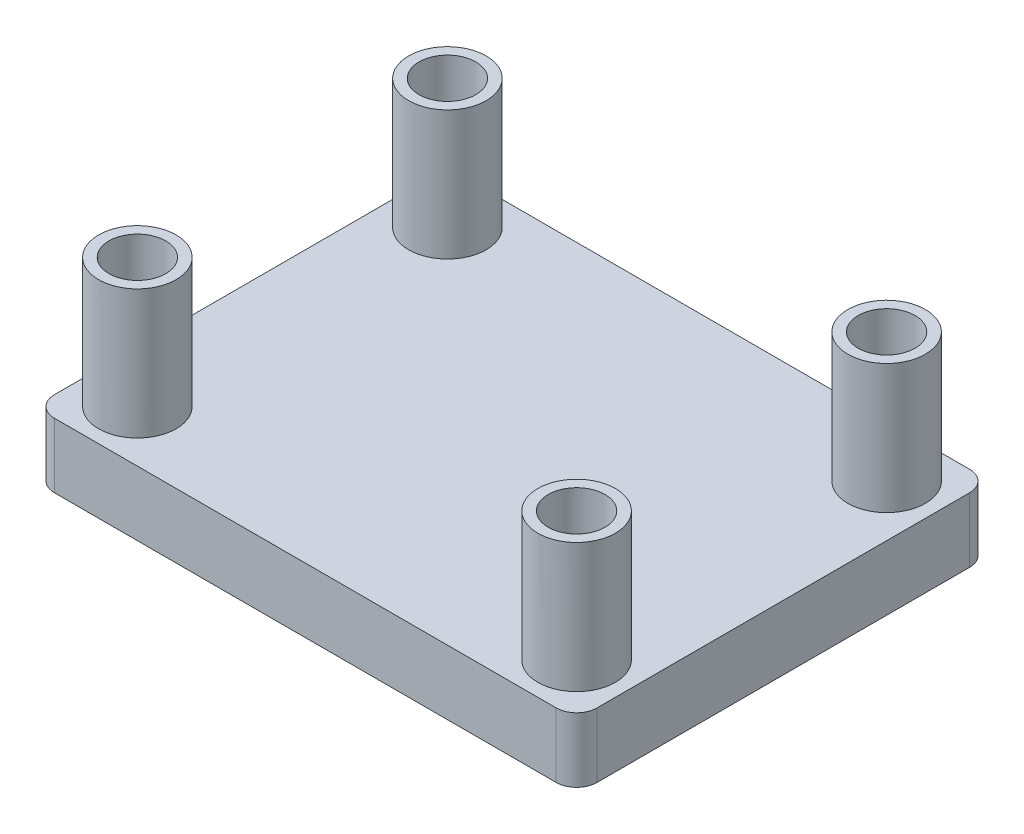
from build123d import *

# Parameters (mm, degrees)
SKETCH1_W           = 26.67
SKETCH1_H           = 20.32
BOSS_EXTRUDE1_DEPTH = 3.175
SKETCH2_R           = 1.905
SKETCH2_R_2         = 1.397
BOSS_EXTRUDE2_DEPTH = 6.35
FILLET1_R           = 1


with BuildPart() as part:
    # Sketch1 → Boss-Extrude1 (new body)
    with BuildSketch(Plane(origin=(0, 0, 0), x_dir=(1, 0, 0), z_dir=(0, 1, 0))):
        with Locations((-10.451352941, 1.434352941)):
            Rectangle(SKETCH1_W, SKETCH1_H)
    extrude(amount=BOSS_EXTRUDE1_DEPTH)

    # Sketch2 → Boss-Extrude2 (add)
    # profile 1 of 4: a face of its own
    with BuildSketch(Plane(origin=(0, 3.175, 0), x_dir=(1, 0, 0), z_dir=(0, 1, 0))):
        with Locations((-21.246352941, 9.054352941)):
            Circle(SKETCH2_R)
        with Locations((-21.246352941, 9.054352941)):
            Circle(SKETCH2_R_2, mode=Mode.SUBTRACT)
    # profile 2 of 4: a face of its own
    with BuildSketch(Plane(origin=(0, 3.175, 0), x_dir=(1, 0, 0), z_dir=(0, 1, 0))):
        with Locations((0.343647059, 9.054352941)):
            Circle(SKETCH2_R)
        with Locations((0.343647059, 9.054352941)):
            Circle(SKETCH2_R_2, mode=Mode.SUBTRACT)
    # profile 3 of 4: a face of its own
    with BuildSketch(Plane(origin=(0, 3.175, 0), x_dir=(1, 0, 0), z_dir=(0, 1, 0))):
        with Locations((0.343647059, -6.185647059)):
            Circle(SKETCH2_R)
        with Locations((0.343647059, -6.185647059)):
            Circle(SKETCH2_R_2, mode=Mode.SUBTRACT)
    # profile 4 of 4: a face of its own
    with BuildSketch(Plane(origin=(0, 3.175, 0), x_dir=(1, 0, 0), z_dir=(0, 1, 0))):
        with Locations((-21.246352941, -6.185647059)):
            Circle(SKETCH2_R)
        with Locations((-21.246352941, -6.185647059)):
            Circle(SKETCH2_R_2, mode=Mode.SUBTRACT)
    extrude(amount=BOSS_EXTRUDE2_DEPTH)

    # Fillet1
    fillet1_edges = [part.edges().sort_by_distance(p)[0] for p in [
        (-23.786352941, 1.5875, -11.594352941),
        (-23.786352941, 1.5875, 8.725647059),
        (2.883647059, 1.5875, -11.594352941),
        (2.883647059, 1.5875, 8.725647059),
    ]]
    fillet(fillet1_edges, radius=FILLET1_R)


solid = part.part
